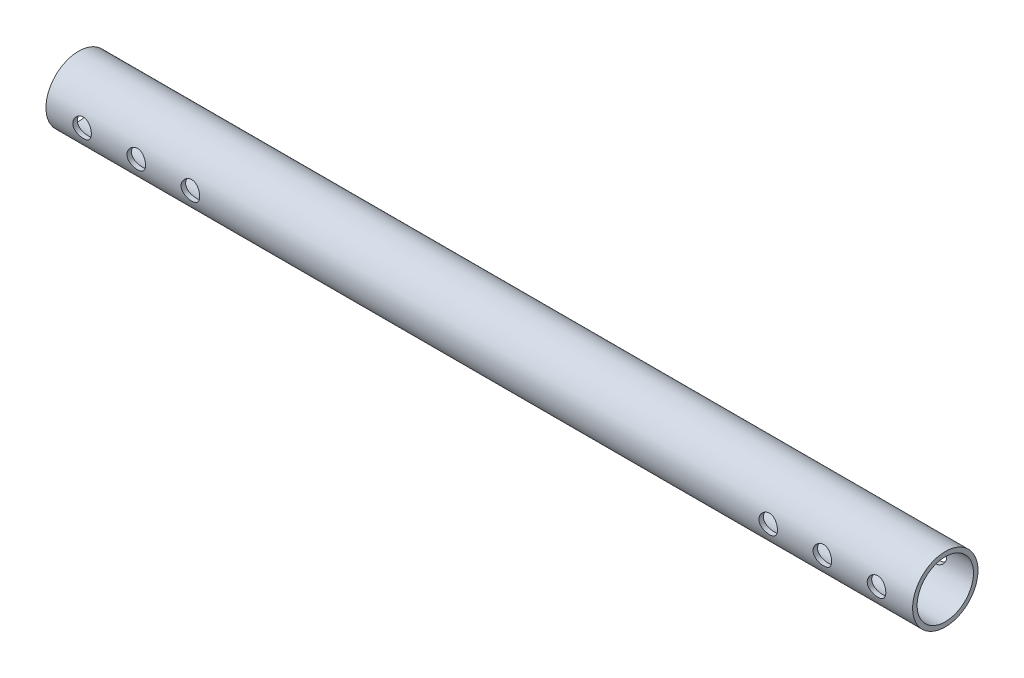
from build123d import *

# Parameters (mm, degrees)
SKETCH1_R               = 11.5
SKETCH1_R_2             = 9.9125
BOSS_EXTRUDE1_DEPTH     = 304.8
CUT_EXTRUDE1_DEPTH      = 306.773674472
CUT_EXTRUDE1_DEPTH_BACK = 306.773674472
SKETCH2_R               = 3.2639


with BuildPart() as part:
    # Sketch1 → Boss-Extrude1 (new body)
    with BuildSketch(Plane(origin=(0, 0, 0), x_dir=(0, 0, -1), z_dir=(1, 0, 0))):
        Circle(SKETCH1_R)
        Circle(SKETCH1_R_2, mode=Mode.SUBTRACT)
    extrude(amount=BOSS_EXTRUDE1_DEPTH)

    # Sketch2 → Cut-Extrude1 (cut, two sides: drawn at the far end of the back side and taken through both)
    with BuildSketch(Plane.XY.offset(10).offset(-CUT_EXTRUDE1_DEPTH_BACK)):
        with Locations((12.7, 0)):
            Circle(SKETCH2_R)
        with Locations((31.75, 0)):
            Circle(SKETCH2_R)
        with Locations((50.8, 0)):
            Circle(SKETCH2_R)
        with Locations((292.1, 0)):
            Circle(SKETCH2_R)
        with Locations((273.05, 0)):
            Circle(SKETCH2_R)
        with Locations((254, 0)):
            Circle(SKETCH2_R)
    extrude(amount=CUT_EXTRUDE1_DEPTH + CUT_EXTRUDE1_DEPTH_BACK, mode=Mode.SUBTRACT)


solid = part.part
